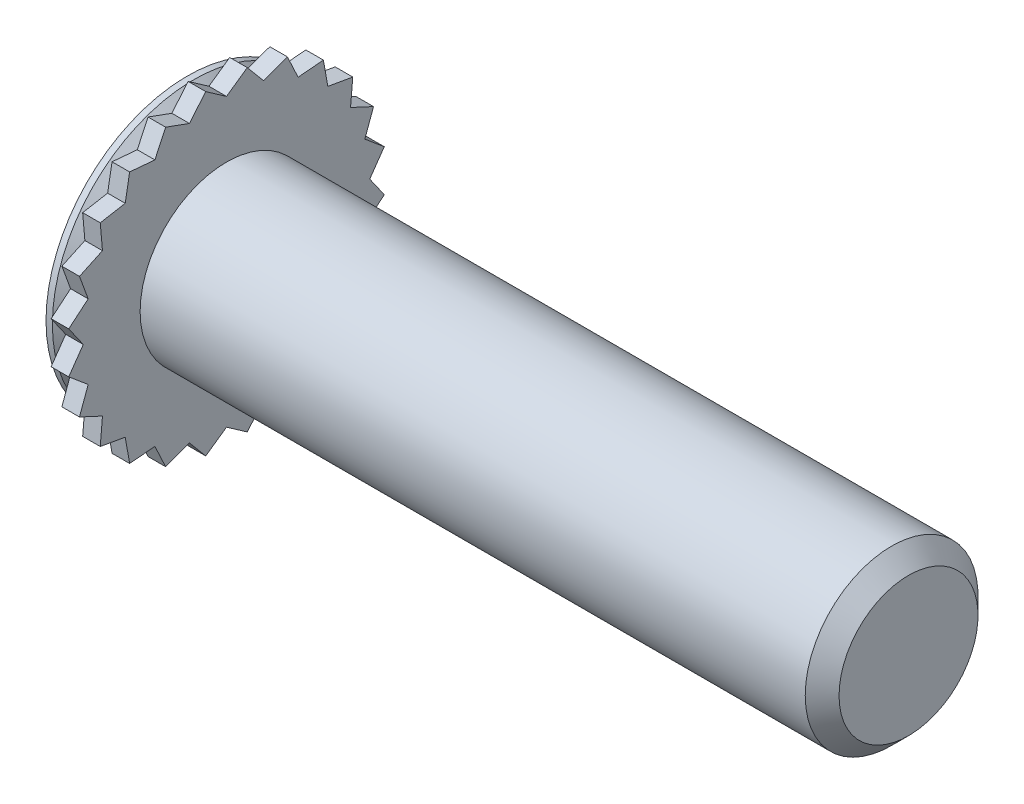
from build123d import *

# Parameters (mm, degrees)
CLINCHCUT_DEPTH    = 0.49149
CLINCHCUTPAT_COUNT = 24
CLINCHCUTPAT_ANGLE = 345


with BuildPart() as part:
    # BodySke → BaseBody (revolve)
    with BuildSketch(Plane.XY):
        Polygon((0, 2.2225), (0, 3.9497), (0.1778, 3.9497), (0.49149, 3.63601), (0.60071, 3.63601), (0.60071, 4.445), (1.0922, 4.445), (1.0922, 2.413), (19.66976, 2.413), (20.1422, 1.94056), (20.1422, 0), (0.5461, 0), (0.5461, 1.6764), align=None)
    revolve(axis=Axis((0, 0, 0), (1, 0, 0)))

    # CliRinCutSke → ClinchCut (cut)
    with BuildSketch(Plane(origin=(1.0922, 0, 0), x_dir=(0, 0, -1), z_dir=(1, 0, 0))):
        with BuildLine():
            Line((0.580188924, 4.406972409), (0, 4.0005))
            Line((0, 4.0005), (-0.580188924, 4.406972409))
            ThreePointArc((-0.580188924, 4.406972409), (0, 4.445), (0.580188924, 4.406972409))
        make_face()
    clinchcut = extrude(amount=-CLINCHCUT_DEPTH, mode=Mode.SUBTRACT)

    # ClinchCutPat: ClinchCut ×24 about axis
    clinchcutpat_axis = Axis((0, 0, 0), (1, 0, 0))
    for i in range(1, CLINCHCUTPAT_COUNT):
        add(clinchcut.rotate(clinchcutpat_axis, i * CLINCHCUTPAT_ANGLE / (CLINCHCUTPAT_COUNT - 1)), mode=Mode.SUBTRACT)


solid = part.part
